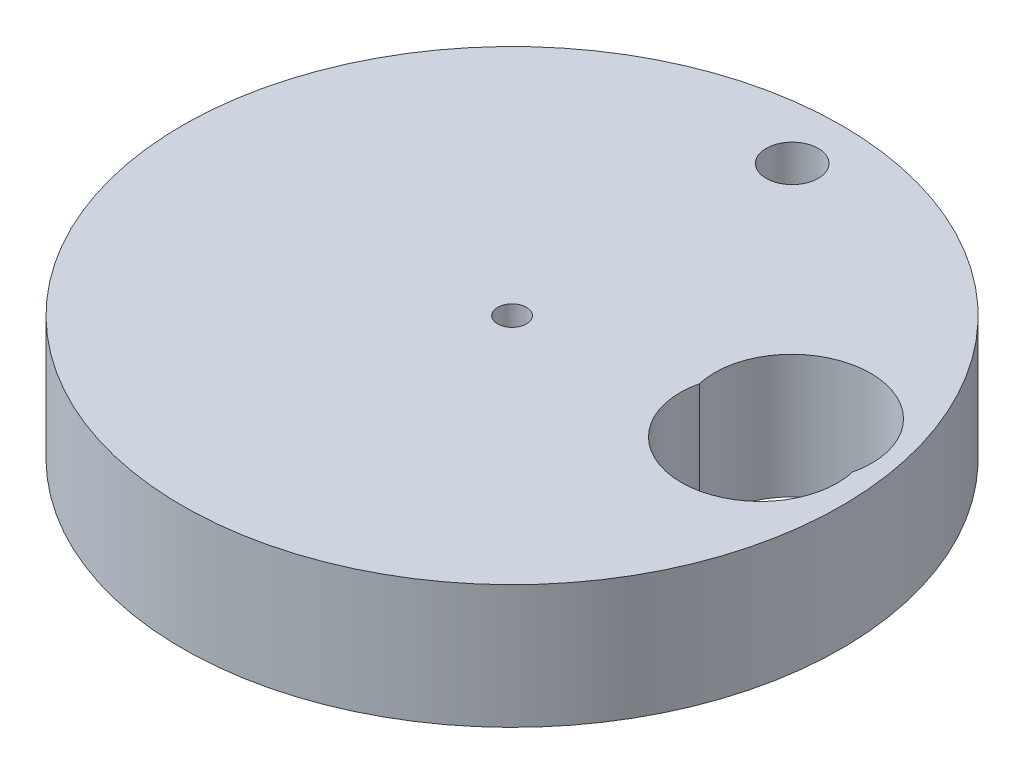
from build123d import *

# Parameters (mm, degrees)
SKETCH1_R           = 50.8
SKETCH1_R_2         = 2.2225
SKETCH1_R_3         = 4.0132
BOSS_EXTRUDE1_DEPTH = 19.05


with BuildPart() as part:
    # Sketch1 → Boss-Extrude1 (new body)
    with BuildSketch(Plane(origin=(0, 0, 0), x_dir=(1, 0, 0), z_dir=(0, 1, 0))):
        Circle(SKETCH1_R)
        Circle(SKETCH1_R_2, mode=Mode.SUBTRACT)
        with BuildLine():
            add(Edge.make_bspline(
                [(47.425, 8.028719366), (47.425, 21.375976625), (33.958540857, 19.868664087), (20.492081715, 18.361351549), (23.533629849, 5.35453743)],
                knots=[0, 0, 0, 1.683968262, 1.683968262, 3.367936524, 3.367936524, 3.367936524], degree=2, weights=[1, 0.665984043, 1, 0.665984043, 1]))
            add(Edge.make_bspline(
                [(47.116370151, 5.35453743), (47.425, 6.674355793), (47.425, 8.028719366)],
                knots=[6.056841437, 6.056841437, 6.056841437, 6.283185307, 6.283185307, 6.283185307], degree=2, weights=[1, 0.993602889, 1]))
            add(Edge.make_bspline(
                [(44.525, -5.059632012), (48.484325385, -0.495358305), (47.116370151, 5.35453743)],
                knots=[5.576210889, 5.576210889, 5.576210889, 6.500952743, 6.500952743, 6.500952743], degree=2, weights=[1, 0.843252924, 0.891535306]))
            add(Edge.make_bspline(
                [(23.533629849, 5.35453743), (23.225, 4.034719066), (23.225, 2.680355494), (23.225, -29.614075135), (44.525, -5.059632012)],
                knots=[2.868291657, 2.868291657, 2.868291657, 3.141592654, 3.141592654, 5.576210889, 5.576210889, 5.576210889], degree=2, weights=[0.869685773, 0.926603696, 1, 0.346171505, 1]))
        make_face(mode=Mode.SUBTRACT)
        with Locations((1.27, 41.91)):
            Circle(SKETCH1_R_3, mode=Mode.SUBTRACT)
    extrude(amount=BOSS_EXTRUDE1_DEPTH)


solid = part.part
